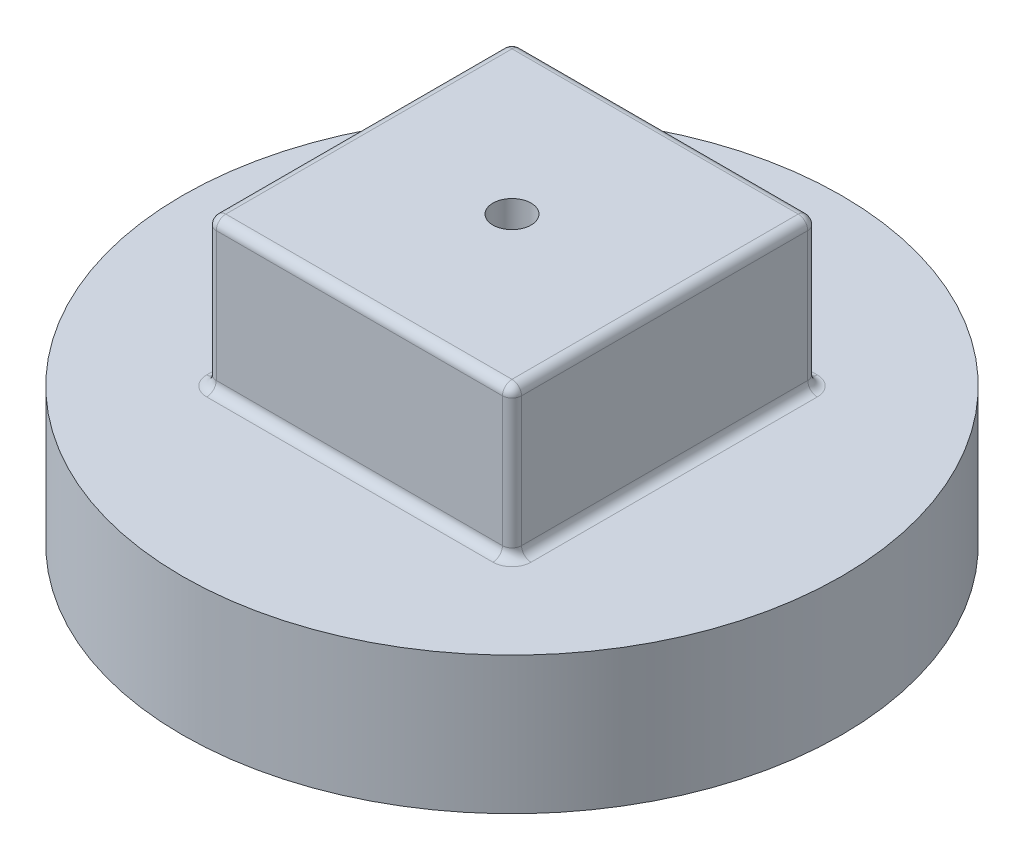
from build123d import *

# Parameters (mm, degrees)
SKETCH2_W               = 50.8
SKETCH2_H               = 50.8
BOSS_EXTRUDE1_DEPTH     = 24.765
SHELL1_START            = -6.731
SHELL1_OUTLINE_W        = 38.1
SHELL1_OUTLINE_H        = 38.1
SHELL1_DEPTH            = 25.146
SHELL1_2_OUTLINE_R      = 48.514
SHELL1_2_OUTLINE_W      = 38.1
SHELL1_2_OUTLINE_H      = 38.1
SHELL1_2_DEPTH          = 0.381
FILLET1_R               = 1.5875
FILLET2_R               = 1.5875
CUT_EXTRUDE1_DEPTH      = 82.445823816
CUT_EXTRUDE1_DEPTH_BACK = 82.445823816
SKETCH3_R               = 3.175


# Read off the part's stored shape, not the designer's step: Shell1
with BuildPart() as part:
    # Sketch1 → Revolve1 (revolve)
    with BuildSketch(Plane.XY, mode=Mode.PRIVATE) as revolve1_sk:
        Polygon((0, 0), (54.864, 0), (54.864, -22.86), (49.784, -22.86), (49.784, -6.731), (0, -6.731), align=None)
    revolve(revolve1_sk.sketch.rotate(Axis((0, -987.311672366, 0), (0, 1, 0)), 90), axis=Axis((0, -987.311672366, 0), (0, 1, 0)))

    # Sketch2 → Boss-Extrude1 (add)
    with BuildSketch(Plane(origin=(0, 0, 0), x_dir=(1, 0, 0), z_dir=(0, 1, 0))):
        Rectangle(SKETCH2_W, SKETCH2_H)
    extrude(amount=BOSS_EXTRUDE1_DEPTH)

    # Shell1 outline → Shell1 (cut)
    with BuildSketch(Plane(origin=(0, 0, 0), x_dir=(1, 0, 0), z_dir=(0, 1, 0)).offset(SHELL1_START)):
        Rectangle(SHELL1_OUTLINE_W, SHELL1_OUTLINE_H)
    extrude(amount=SHELL1_DEPTH, mode=Mode.SUBTRACT)

    # Shell1 2 outline → Shell1 2 (cut)
    with BuildSketch(Plane(origin=(0, 0, 0), x_dir=(1, 0, 0), z_dir=(0, 1, 0)).offset(SHELL1_START)):
        Circle(SHELL1_2_OUTLINE_R)
        Rectangle(SHELL1_2_OUTLINE_W, SHELL1_2_OUTLINE_H, mode=Mode.SUBTRACT)
    extrude(amount=SHELL1_2_DEPTH, mode=Mode.SUBTRACT)

    # Fillet1
    fillet1_edges = [part.edges().sort_by_distance(p)[0] for p in [
        (-25.4, 12.3825, -25.4),
        (-25.4, 12.3825, 25.4),
        (25.4, 12.3825, 25.4),
        (25.4, 12.3825, -25.4),
    ]]
    fillet(fillet1_edges, radius=FILLET1_R)

    # Fillet2
    fillet2_edges = [part.edges().sort_by_distance(p)[0] for p in [
        (0, 0, -25.4),
        (0, 24.765, -25.4),
        (25.4, 0, 0),
        (25.4, 24.765, 0),
        (-25.4, 24.765, 0),
        (0, 24.765, 25.4),
        (-24.935032015, 24.765, -24.935032015),
        (-24.935032015, 24.765, 24.935032015),
        (24.935032015, 24.765, 24.935032015),
        (24.935032015, 24.765, -24.935032015),
        (0, 0, 25.4),
        (-25.4, 0, 0),
        (24.935032015, 0, -24.935032015),
        (24.935032015, 0, 24.935032015),
        (-24.935032015, 0, 24.935032015),
        (-24.935032015, 0, -24.935032015),
    ]]
    fillet(fillet2_edges, radius=FILLET2_R)

    # Sketch3 → Cut-Extrude1 (cut, two sides: drawn at the far end of the back side and taken through both)
    with BuildSketch(Plane(origin=(0, 0, 0), x_dir=(1, 0, 0), z_dir=(0, 1, 0)).offset(-CUT_EXTRUDE1_DEPTH_BACK)):
        with Locations(Location((0, 0, 0), (0, 0, 270))):
            Circle(SKETCH3_R)
    extrude(amount=CUT_EXTRUDE1_DEPTH + CUT_EXTRUDE1_DEPTH_BACK, mode=Mode.SUBTRACT)


solid = part.part
